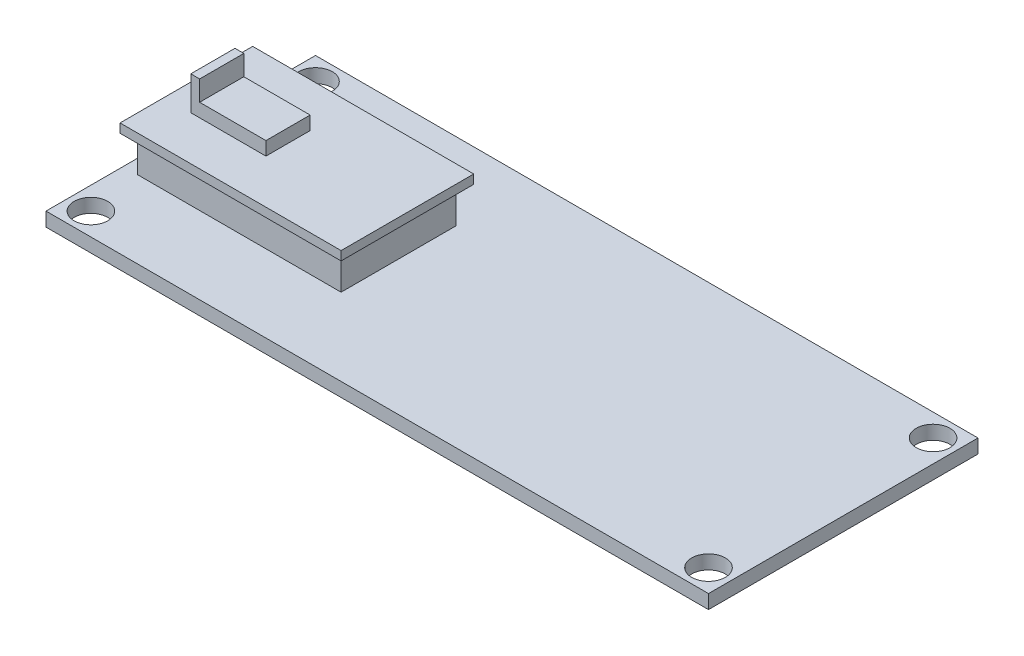
from build123d import *

# Parameters (mm, degrees)
SKETCH1_W           = 74.93
SKETCH1_H           = 30.48
SKETCH1_R           = 1.905
BOSS_EXTRUDE1_DEPTH = 1.5748
SKETCH2_W           = 25
SKETCH2_H           = 15
BOSS_EXTRUDE2_DEPTH = 5.08
CUT_EXTRUDE1_START  = -1.016
SKETCH3_W           = 25
SKETCH3_H           = 15
SKETCH3_W_2         = 23
SKETCH3_H_2         = 13
CUT_EXTRUDE1_DEPTH  = 4.064
SKETCH4_W           = 8.5
SKETCH4_H           = 5
BOSS_EXTRUDE3_DEPTH = 1.524
SKETCH5_W           = 1
SKETCH5_H           = 5
BOSS_EXTRUDE4_DEPTH = 2.286


with BuildPart() as part:
    # Sketch1 → Boss-Extrude1 (new body)
    with BuildSketch(Plane(origin=(0, 0, 0), x_dir=(1, 0, 0), z_dir=(0, 1, 0))):
        Rectangle(SKETCH1_W, SKETCH1_H)
        with Locations((-34.925, 12.7)):
            Circle(SKETCH1_R, mode=Mode.SUBTRACT)
        with Locations((34.925, 12.7)):
            Circle(SKETCH1_R, mode=Mode.SUBTRACT)
        with Locations((-34.925, -12.7)):
            Circle(SKETCH1_R, mode=Mode.SUBTRACT)
        with Locations((34.925, -12.7)):
            Circle(SKETCH1_R, mode=Mode.SUBTRACT)
    extrude(amount=-BOSS_EXTRUDE1_DEPTH)

    # Sketch2 → Boss-Extrude2 (add)
    with BuildSketch(Plane(origin=(0, 0, 0), x_dir=(1, 0, 0), z_dir=(0, 1, 0))):
        with Locations((-24.33, 0)):
            Rectangle(SKETCH2_W, SKETCH2_H)
    extrude(amount=BOSS_EXTRUDE2_DEPTH)

    # Sketch3 → Cut-Extrude1 (cut)
    with BuildSketch(Plane(origin=(0, 5.08, 0), x_dir=(1, 0, 0), z_dir=(0, 1, 0)).offset(CUT_EXTRUDE1_START)):
        with Locations((-24.33, 0)):
            Rectangle(SKETCH3_W, SKETCH3_H)
        with Locations((-24.33, 0)):
            Rectangle(SKETCH3_W_2, SKETCH3_H_2, mode=Mode.SUBTRACT)
    extrude(amount=-CUT_EXTRUDE1_DEPTH, mode=Mode.SUBTRACT)

    # Sketch4 → Boss-Extrude3 (add)
    with BuildSketch(Plane(origin=(0, 5.08, 0), x_dir=(1, 0, 0), z_dir=(0, 1, 0))):
        with Locations((-29.58, 0)):
            Rectangle(SKETCH4_W, SKETCH4_H)
    extrude(amount=BOSS_EXTRUDE3_DEPTH)

    # Sketch5 → Boss-Extrude4 (add)
    with BuildSketch(Plane(origin=(0, 6.604, 0), x_dir=(1, 0, 0), z_dir=(0, 1, 0))):
        with Locations((-33.33, 0)):
            Rectangle(SKETCH5_W, SKETCH5_H)
    extrude(amount=BOSS_EXTRUDE4_DEPTH)


solid = part.part
